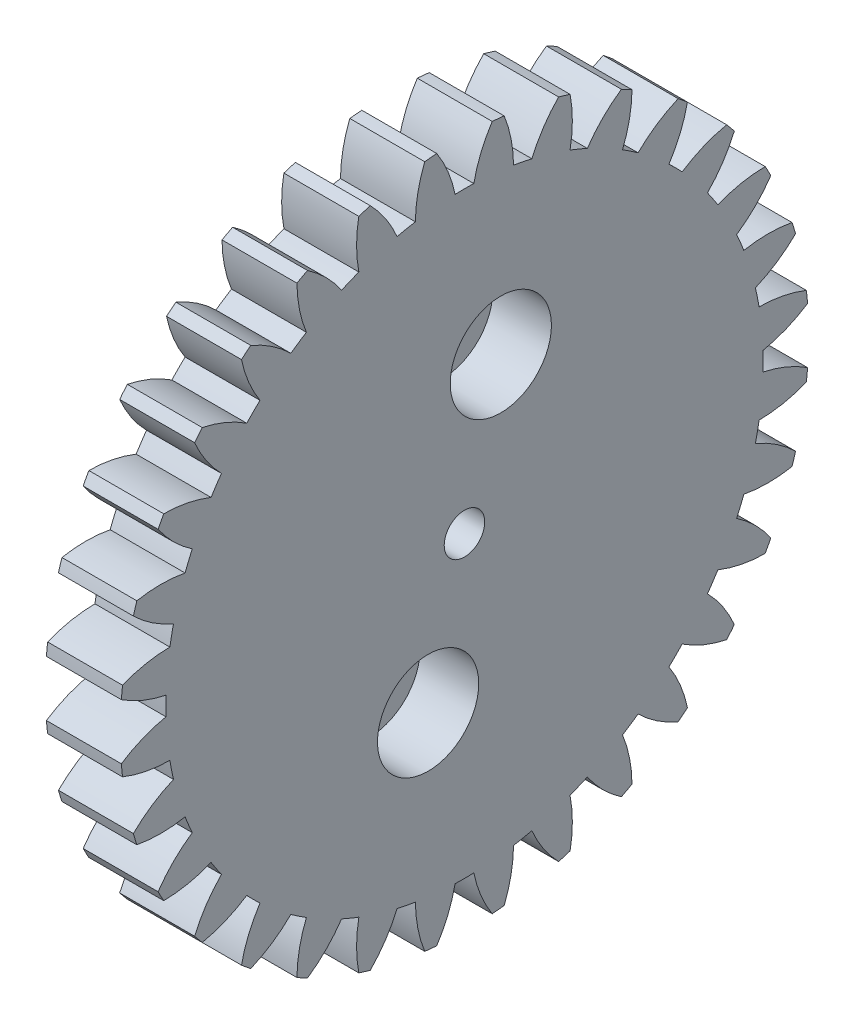
from build123d import *

# Parameters (mm, degrees)
BASPROSKE_W        = 3.7
BASPROSKE_H        = 17
TOOTHCUT_DEPTH     = 25.324678826
TEETHCUTS_COUNT    = 32
TEETHCUTS_ANGLE    = 348.75
BORSKE_R           = 1
BORE_DEPTH         = 50.0194056
SKETCH1_R          = 1.4
CUT_EXTRUDE1_DEPTH = 9
SKETCH3_R          = 2.5
CUT_EXTRUDE3_DEPTH = 2.9


with BuildPart() as part:
    # BasProSke → Base-Revolve (revolve)
    with BuildSketch(Plane(origin=(0, 0, 0), x_dir=(1, 0, 0), z_dir=(0, 1, 0))):
        with Locations((1.85, 8.5)):
            Rectangle(BASPROSKE_W, BASPROSKE_H)
    revolve(axis=Axis((-10, 0, 0), (1, 0, 0)))

    # TooCutSke → ToothCut (cut, through all)
    with BuildSketch(Plane(origin=(0, 0, 0), x_dir=(0, 0, -1), z_dir=(1, 0, 0))):
        with BuildLine():
            ThreePointArc((0.462036907, 14.741761187), (0, 14.749), (-0.462036907, 14.741761187))
            ThreePointArc((-0.462036907, 14.741761187), (-0.81854142, 15.899240468), (-1.386721275, 16.9688317))
            ThreePointArc((-1.386721275, 16.9688317), (0, 17.0254), (1.386721275, 16.9688317))
            ThreePointArc((1.386721275, 16.9688317), (0.81854142, 15.899240468), (0.462036907, 14.741761187))
        make_face()
    toothcut = extrude(amount=TOOTHCUT_DEPTH, mode=Mode.SUBTRACT)

    # TeethCuts: ToothCut ×32 about axis
    teethcuts_axis = Axis((-10, 0, 0), (1, 0, 0))
    for i in range(1, TEETHCUTS_COUNT):
        add(toothcut.rotate(teethcuts_axis, i * TEETHCUTS_ANGLE / (TEETHCUTS_COUNT - 1)), mode=Mode.SUBTRACT)

    # BorSke → Bore (cut, symmetric)
    with BuildSketch(Plane(origin=(0, 0, 0), x_dir=(0, 0, -1), z_dir=(1, 0, 0))):
        Circle(BORSKE_R)
    extrude(amount=BORE_DEPTH, both=True, mode=Mode.SUBTRACT)

    # Sketch1 → Cut-Extrude1 (cut)
    with BuildSketch(Plane(origin=(3.7, -25.519232262, 100.200121909), x_dir=(0, -0.4009718669223507, -0.9160903677786406), z_dir=(1, 0, 0))):
        with Locations((82.628134559, 56.637346181)):
            Circle(SKETCH1_R)
        with Locations((80.491610098, 70.473359451)):
            Circle(SKETCH1_R)
    extrude(amount=-CUT_EXTRUDE1_DEPTH, mode=Mode.SUBTRACT)

    # Sketch3 → Cut-Extrude3 (cut)
    with BuildSketch(Plane(origin=(3.7, -25.519232262, 100.200121909), x_dir=(0, -0.4009718669223507, -0.9160903677786406), z_dir=(1, 0, 0))):
        with Locations((82.628134559, 56.637346181)):
            Circle(SKETCH3_R)
        with Locations((80.491610098, 70.473359451)):
            Circle(SKETCH3_R)
    extrude(amount=-CUT_EXTRUDE3_DEPTH, mode=Mode.SUBTRACT)


solid = part.part
